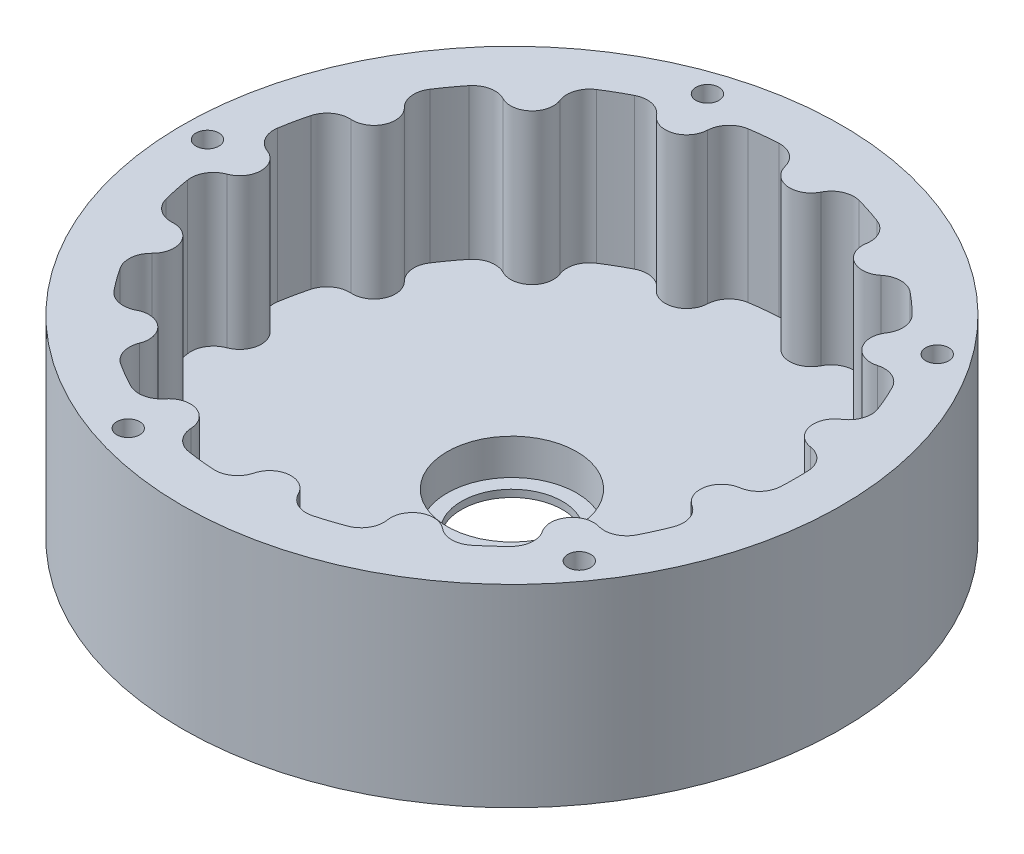
from build123d import *

# Parameters (mm, degrees)
SKETCH1_R            = 46
BOSS_EXTRUDE1_DEPTH  = 27
SKETCH1_3_R          = 46
BOSS_EXTRUDE2_DEPTH  = 6
SKETCH2_R            = 7.05
CUT_EXTRUDE1_DEPTH   = 71.434366612
CUT_EXTRUDE2_START   = 1
SKETCH2_3_R          = 9.05
SKETCH2_3_R_2        = 7.05
CUT_EXTRUDE2_DEPTH   = 70.434366612
M3_CLEARANCE_HOLE1_D = 3.2
CIRPATTERN1_COUNT    = 5


with BuildPart() as part:
    # Sketch1 → Boss-Extrude1 (new body)
    with BuildSketch(Plane(origin=(0, 0, 0), x_dir=(1, 0, 0), z_dir=(0, 1, 0))):
        Circle(SKETCH1_R)
        with BuildLine():
            ThreePointArc((-38.994571123, -6.298684221), (-38.602185265, -4.191732911), (-36.960419774, -2.814120281))
            ThreePointArc((-36.960419774, -2.814120281), (-35, 0), (-36.960419774, 2.814120281))
            ThreePointArc((-36.960419774, 2.814120281), (-38.602185265, 4.191732911), (-38.994571123, 6.298684221))
            ThreePointArc((-38.994571123, 6.298684221), (-38.827494163, 7.257802493), (-38.636830229, 8.212511787))
            ThreePointArc((-38.636830229, 8.212511787), (-38.422695146, 9.162232135), (-38.185218998, 10.106386598))
            ThreePointArc((-38.185218998, 10.106386598), (-36.969782377, 11.87158469), (-34.909629433, 12.462330266))
            ThreePointArc((-34.909629433, 12.462330266), (-31.974091017, 14.235782508), (-32.620417761, 17.603983865))
            ThreePointArc((-32.620417761, 17.603983865), (-33.559919631, 19.53026181), (-33.061407647, 21.614655316))
            ThreePointArc((-33.061407647, 21.614655316), (-32.518666702, 22.422897135), (-31.956171278, 23.217517466))
            ThreePointArc((-31.956171278, 23.217517466), (-31.37426308, 23.99803359), (-30.773295606, 24.76397136))
            ThreePointArc((-30.773295606, 24.76397136), (-28.944968255, 25.882197447), (-26.82264702, 25.583930693))
            ThreePointArc((-26.82264702, 25.583930693), (-23.419571223, 26.010068892), (-22.64004917, 29.349958712))
            ThreePointArc((-22.64004917, 29.349958712), (-22.714839011, 31.491831016), (-21.411626434, 33.193256144))
            ThreePointArc((-21.411626434, 33.193256144), (-20.587066345, 33.710869157), (-19.75, 34.208003449))
            ThreePointArc((-19.75, 34.208003449), (-18.900935901, 34.684357023), (-18.040389838, 35.139640501))
            ThreePointArc((-18.040389838, 35.139640501), (-15.915306166, 35.417543134), (-14.09778526, 34.28183708))
            ThreePointArc((-14.09778526, 34.28183708), (-10.815594803, 33.28697807), (-8.745010399, 36.021059062))
            ThreePointArc((-8.745010399, 36.021059062), (-7.942156368, 38.008176545), (-6.059580493, 39.032441433))
            ThreePointArc((-6.059580493, 39.032441433), (-5.09577519, 39.169925647), (-4.128874299, 39.283614867))
            ThreePointArc((-4.128874299, 39.283614867), (-3.159465195, 39.373440029), (-2.188136774, 39.439346565))
            ThreePointArc((-2.188136774, 39.439346565), (-0.133743055, 38.828873854), (1.064711645, 37.052102396))
            ThreePointArc((1.064711645, 37.052102396), (3.658496214, 34.808266338), (6.662120116, 36.463791059))
            ThreePointArc((6.662120116, 36.463791059), (8.203797264, 37.952563055), (10.340221965, 38.122563))
            ThreePointArc((10.340221965, 38.122563), (11.276621789, 37.856146146), (12.206171278, 37.566732394))
            ThreePointArc((12.206171278, 37.566732394), (13.128305747, 37.254497557), (14.042465016, 36.919631313))
            ThreePointArc((14.042465016, 36.919631313), (15.670945446, 35.526339536), (16.043110235, 33.415722599))
            ThreePointArc((16.043110235, 33.415722599), (17.5, 30.310889132), (20.917309539, 30.601602319))
            ThreePointArc((20.917309539, 30.601602319), (22.931239819, 31.334606626), (24.952106107, 30.620947092))
            ThreePointArc((24.952106107, 30.620947092), (25.699188416, 29.996695064), (26.430658951, 29.354220606))
            ThreePointArc((26.430658951, 29.354220606), (27.146073357, 28.693914011), (27.844997033, 28.016176403))
            ThreePointArc((27.844997033, 28.016176403), (28.765985113, 26.080978366), (28.247509317, 24.001460793))
            ThreePointArc((28.247509317, 24.001460793), (28.315594803, 20.57248383), (31.555706116, 19.448118531))
            ThreePointArc((31.555706116, 19.448118531), (33.693662686, 19.298612044), (35.249544421, 17.824691249))
            ThreePointArc((35.249544421, 17.824691249), (35.678131896, 16.950542893), (36.085045577, 16.066097401))
            ThreePointArc((36.085045577, 16.066097401), (36.47003827, 15.171892057), (36.8328761, 14.268470073))
            ThreePointArc((36.8328761, 14.268470073), (36.887124623, 12.125979097), (35.567657418, 10.437128369))
            ThreePointArc((35.567657418, 10.437128369), (34.235166026, 7.276909179), (36.73783443, 4.931878368))
            ThreePointArc((36.73783443, 4.931878368), (38.630145177, 3.925712118), (39.452016272, 1.946384357))
            ThreePointArc((39.452016272, 1.946384357), (39.488002246, 0.973487866), (39.5, 0))
            ThreePointArc((39.5, 0), (39.488002246, -0.973487866), (39.452016272, -1.946384357))
            ThreePointArc((39.452016272, -1.946384357), (38.630145177, -3.925712118), (36.73783443, -4.931878368))
            ThreePointArc((36.73783443, -4.931878368), (34.235166026, -7.276909179), (35.567657418, -10.437128369))
            ThreePointArc((35.567657418, -10.437128369), (36.887124623, -12.125979097), (36.8328761, -14.268470073))
            ThreePointArc((36.8328761, -14.268470073), (36.47003827, -15.171892057), (36.085045577, -16.066097401))
            ThreePointArc((36.085045577, -16.066097401), (35.678131896, -16.950542893), (35.249544421, -17.824691249))
            ThreePointArc((35.249544421, -17.824691249), (33.693662686, -19.298612044), (31.555706116, -19.448118531))
            ThreePointArc((31.555706116, -19.448118531), (28.315594803, -20.57248383), (28.247509317, -24.001460793))
            ThreePointArc((28.247509317, -24.001460793), (28.765985113, -26.080978366), (27.844997033, -28.016176403))
            ThreePointArc((27.844997033, -28.016176403), (27.146073357, -28.693914011), (26.430658951, -29.354220606))
            ThreePointArc((26.430658951, -29.354220606), (25.699188416, -29.996695064), (24.952106107, -30.620947092))
            ThreePointArc((24.952106107, -30.620947092), (22.931239819, -31.334606626), (20.917309539, -30.601602319))
            ThreePointArc((20.917309539, -30.601602319), (17.5, -30.310889132), (16.043110235, -33.415722599))
            ThreePointArc((16.043110235, -33.415722599), (15.670945446, -35.526339536), (14.042465016, -36.919631313))
            ThreePointArc((14.042465016, -36.919631313), (13.128305747, -37.254497557), (12.206171278, -37.566732394))
            ThreePointArc((12.206171278, -37.566732394), (11.276621789, -37.856146146), (10.340221965, -38.122563))
            ThreePointArc((10.340221965, -38.122563), (8.203797264, -37.952563055), (6.662120116, -36.463791059))
            ThreePointArc((6.662120116, -36.463791059), (3.658496214, -34.808266338), (1.064711645, -37.052102396))
            ThreePointArc((1.064711645, -37.052102396), (-0.133743055, -38.828873854), (-2.188136774, -39.439346565))
            ThreePointArc((-2.188136774, -39.439346565), (-3.159465195, -39.373440029), (-4.128874299, -39.283614867))
            ThreePointArc((-4.128874299, -39.283614867), (-5.09577519, -39.169925647), (-6.059580493, -39.032441433))
            ThreePointArc((-6.059580493, -39.032441433), (-7.942156368, -38.008176545), (-8.745010399, -36.021059062))
            ThreePointArc((-8.745010399, -36.021059062), (-10.815594803, -33.28697807), (-14.09778526, -34.28183708))
            ThreePointArc((-14.09778526, -34.28183708), (-15.915306166, -35.417543134), (-18.040389838, -35.139640501))
            ThreePointArc((-18.040389838, -35.139640501), (-18.900935901, -34.684357023), (-19.75, -34.208003449))
            ThreePointArc((-19.75, -34.208003449), (-20.587066345, -33.710869157), (-21.411626434, -33.193256144))
            ThreePointArc((-21.411626434, -33.193256144), (-22.714839011, -31.491831016), (-22.64004917, -29.349958712))
            ThreePointArc((-22.64004917, -29.349958712), (-23.419571223, -26.010068892), (-26.82264702, -25.583930693))
            ThreePointArc((-26.82264702, -25.583930693), (-28.944968255, -25.882197447), (-30.773295606, -24.76397136))
            ThreePointArc((-30.773295606, -24.76397136), (-31.37426308, -23.99803359), (-31.956171278, -23.217517466))
            ThreePointArc((-31.956171278, -23.217517466), (-32.518666702, -22.422897135), (-33.061407647, -21.614655316))
            ThreePointArc((-33.061407647, -21.614655316), (-33.559919631, -19.53026181), (-32.620417761, -17.603983865))
            ThreePointArc((-32.620417761, -17.603983865), (-31.974091017, -14.235782508), (-34.909629433, -12.462330266))
            ThreePointArc((-34.909629433, -12.462330266), (-36.969782377, -11.87158469), (-38.185218998, -10.106386598))
            ThreePointArc((-38.185218998, -10.106386598), (-38.422695146, -9.162232135), (-38.636830229, -8.212511787))
            ThreePointArc((-38.636830229, -8.212511787), (-38.827494163, -7.257802493), (-38.994571123, -6.298684221))
        make_face(mode=Mode.SUBTRACT)
    extrude(amount=BOSS_EXTRUDE1_DEPTH)

    # Sketch1<3> → Boss-Extrude2 (add)
    with BuildSketch(Plane(origin=(0, 0, 0), x_dir=(1, 0, 0), z_dir=(0, 1, 0))):
        Circle(SKETCH1_3_R)
    extrude(amount=BOSS_EXTRUDE2_DEPTH)

    # Sketch2 → Cut-Extrude1 (cut, through all)
    with BuildSketch(Plane(origin=(0, 0, 0), x_dir=(1, 0, 0), z_dir=(0, 1, 0))):
        Circle(SKETCH2_R)
    extrude(amount=CUT_EXTRUDE1_DEPTH, mode=Mode.SUBTRACT)

    # Sketch2<3> → Cut-Extrude2 (cut, through all)
    with BuildSketch(Plane(origin=(0, 0, 0), x_dir=(1, 0, 0), z_dir=(0, 1, 0)).offset(CUT_EXTRUDE2_START)):
        Circle(SKETCH2_3_R)
        Circle(SKETCH2_3_R_2, mode=Mode.SUBTRACT)
    extrude(amount=CUT_EXTRUDE2_DEPTH, mode=Mode.SUBTRACT)

    # M3 Clearance Hole1 (through all)
    with Locations(Plane(origin=(0, 27, 0), x_dir=(1, 0, 0), z_dir=(0, 1, 0))):
        with Locations((-42.5, 0)):
            m3_clearance_hole1 = Hole(M3_CLEARANCE_HOLE1_D / 2)

    # CirPattern1: M3 Clearance Hole1 ×5 about axis
    cirpattern1_axis = Axis((0, 27, 0), (0, -1, 0))
    for i in range(1, CIRPATTERN1_COUNT):
        add(m3_clearance_hole1.rotate(cirpattern1_axis, i * 360 / CIRPATTERN1_COUNT), mode=Mode.SUBTRACT)


solid = part.part
